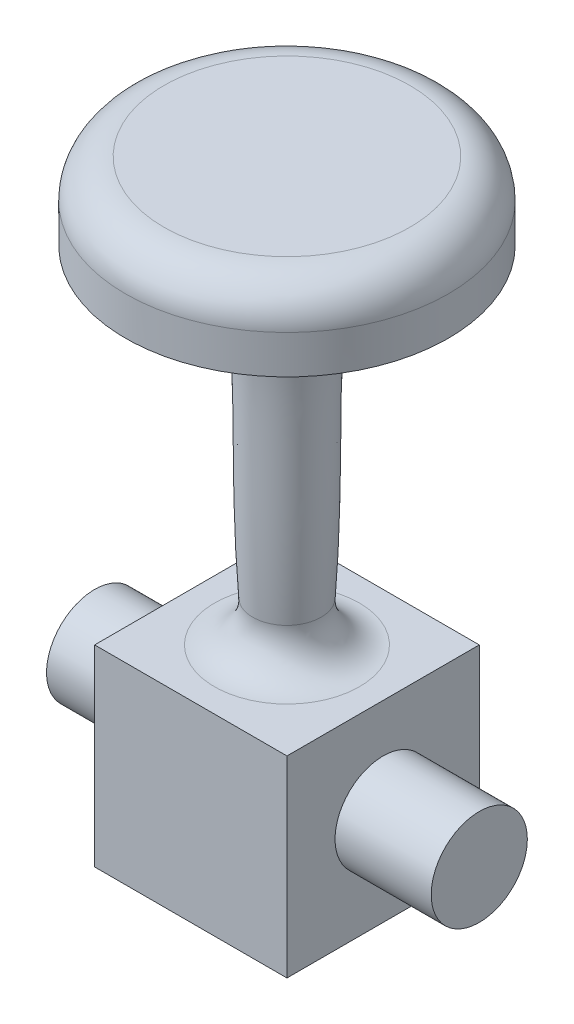
from build123d import *

# Parameters (mm, degrees)
SKETCH2_W          = 12.7
SKETCH2_H          = 12.7
CENTRAL_BOX_DEPTH  = 12.7
NIBBLES_DEPTH      = 6.35
NIBBLES_DEPTH_BACK = 19.05
SKETCH4_R          = 3.175
YAY_ROUNDED_R      = 2.54


with BuildPart() as part:
    # Sketch2 → central box (new body)
    with BuildSketch(Plane(origin=(0, 0, 0), x_dir=(0, 0, -1), z_dir=(1, 0, 0))):
        with Locations((6.35, 6.35)):
            Rectangle(SKETCH2_W, SKETCH2_H)
    extrude(amount=CENTRAL_BOX_DEPTH)

    # Sketch4 → nibbles (add, two sides: drawn at the far end of the back side and taken through both)
    with BuildSketch(Plane(origin=(12.7, 0, 0), x_dir=(0, 0, -1), z_dir=(1, 0, 0)).offset(-NIBBLES_DEPTH_BACK)):
        with Locations((6.35, 6.35)):
            Circle(SKETCH4_R)
    extrude(amount=NIBBLES_DEPTH + NIBBLES_DEPTH_BACK)

    # Sketch6 → stick (revolve)
    with BuildSketch(Plane.XY.offset(-6.35)):
        with BuildLine():
            Line((6.35, 12.7), (6.35, 40.64))
            Line((6.35, 40.64), (17.007592302, 40.64))
            Line((17.007592302, 40.64), (17.007592302, 35.56))
            add(Edge.make_bspline(
                [(17.007592302, 35.56), (6.087452433, 40.534976056), (9.952748947, 28.574992371), (8.382, 12.7)],
                knots=[0, 0, 0, 0, 1, 1, 1, 1], degree=3))
            Line((8.382, 12.7), (6.35, 12.7))
        make_face()
    revolve(axis=Axis((6.35, 12.7, -6.35), (0, 1, 0)))

    # yay, rounded
    yay_rounded_edges = [part.edges().sort_by_distance(p)[0] for p in [
        (4.318, 12.7, -6.35),
        (-4.307592302, 40.64, -6.35),
    ]]
    fillet(yay_rounded_edges, radius=YAY_ROUNDED_R)


solid = part.part
